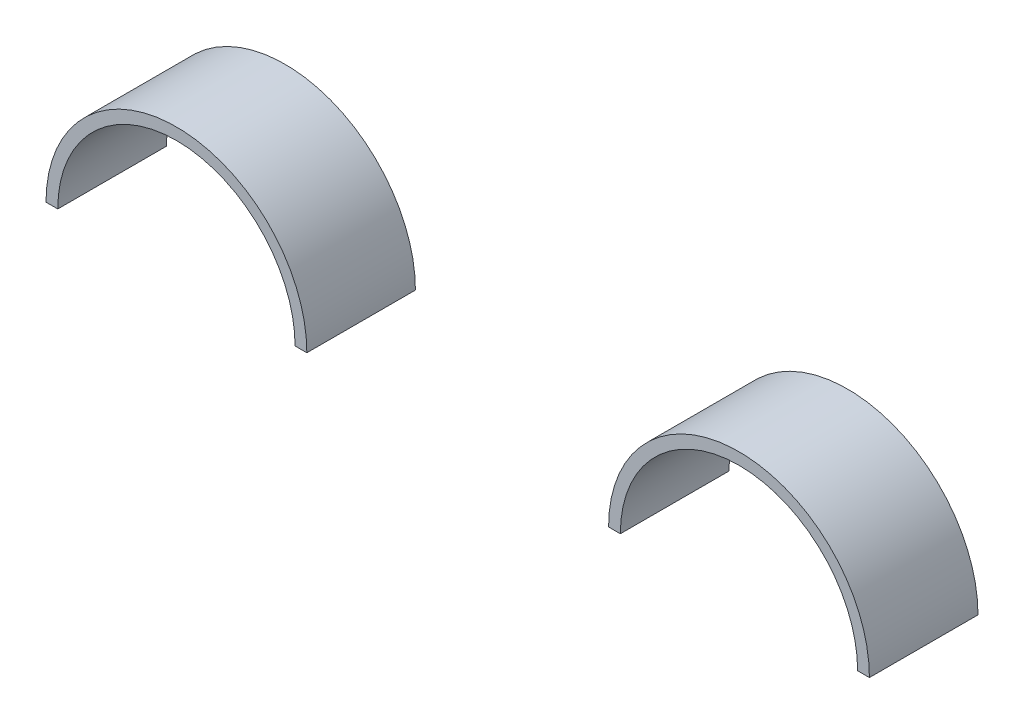
from build123d import *

# Parameters (mm, degrees)
BOSS_EXTRUDE1_DEPTH   = 40.56
BOSS_EXTRUDE1_2_DEPTH = 40.56


with BuildPart() as part:
    # Sketch1 → Boss-Extrude1 (new body)
    with BuildSketch(Plane(origin=(0, 0, 563.242336202), x_dir=(0, -1, 0), z_dir=(0, 0, -1))):
        with BuildLine():
            Line((326.790615215, -1394.880472759), (326.790615215, -1399.280472759))
            ThreePointArc((326.790615215, -1399.280472759), (282.467615215, -1443.603472759), (326.790615215, -1487.926472759))
            Line((326.790615215, -1487.926472759), (326.790615215, -1492.326472759))
            ThreePointArc((326.790615215, -1492.326472759), (278.067615215, -1443.603472759), (326.790615215, -1394.880472759))
        make_face()
    extrude(amount=BOSS_EXTRUDE1_DEPTH)


with BuildPart() as body_2:
    # Sketch1 → Boss-Extrude1 2 (new body)
    with BuildSketch(Plane(origin=(0, 0, 563.242336202), x_dir=(0, -1, 0), z_dir=(0, 0, -1))):
        with BuildLine():
            Line((326.790615215, -1698.080472759), (326.790615215, -1702.480472759))
            ThreePointArc((326.790615215, -1702.480472759), (278.067615215, -1653.757472759), (326.790615215, -1605.034472759))
            Line((326.790615215, -1605.034472759), (326.790615215, -1609.434472759))
            ThreePointArc((326.790615215, -1609.434472759), (282.467615215, -1653.757472759), (326.790615215, -1698.080472759))
        make_face()
    extrude(amount=BOSS_EXTRUDE1_2_DEPTH)


solid = Compound([part.part, body_2.part])
